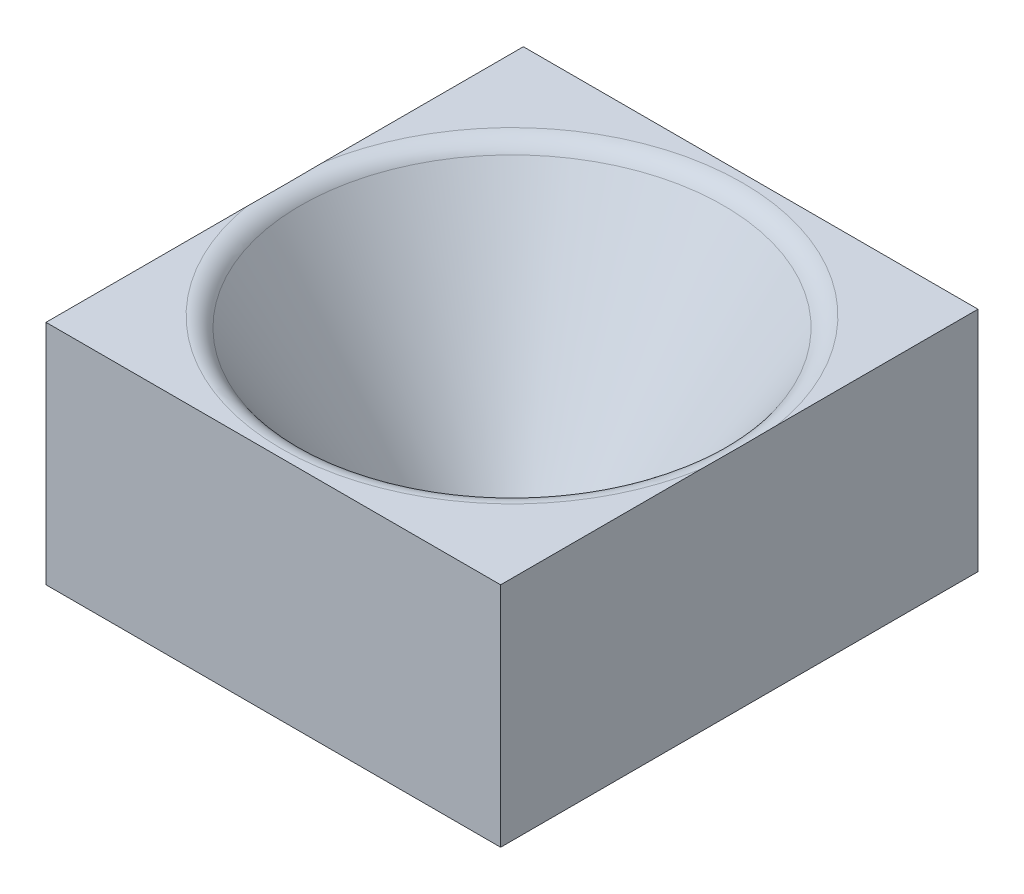
from build123d import *

# Parameters (mm, degrees)
SKETCH1_W           = 100
SKETCH1_H           = 105
BOSS_EXTRUDE1_DEPTH = 50
FILLET1_R           = 5
SKETCH8_W           = 22.5
SKETCH8_H           = 12.5
CUT_EXTRUDE4_DEPTH  = 30
SKETCH9_W           = 33.5
SKETCH9_H           = 12.5
CUT_EXTRUDE5_DEPTH  = 12


with BuildPart() as part:
    # Sketch1 → Boss-Extrude1 (new body)
    with BuildSketch(Plane(origin=(0, 0, 0), x_dir=(1, 0, 0), z_dir=(0, 1, 0))):
        Rectangle(SKETCH1_W, SKETCH1_H)
    extrude(amount=BOSS_EXTRUDE1_DEPTH)

    # Sketch5 → Cut-Revolve1 (revolve, cut)
    with BuildSketch(Plane(origin=(0, 0, 0), x_dir=(0, 0, -1), z_dir=(1, 0, 0))):
        Polygon((-48, 50), (-15, 0), (0, 0), (0, 50), align=None)
    revolve(axis=Axis((0, -20.231136995, 0), (0, 1, 0)), mode=Mode.SUBTRACT)

    # Fillet1
    # the kernel refuses this fillet: 5 mm, written as the material it takes off along each edge
    with BuildSketch(Plane(origin=(0, 50, 0), x_dir=(0, 0, 1), z_dir=(-1, 0, 0))) as fillet1_piece_1:
        with BuildLine():
            CenterArc((48 + FILLET1_R * 0.53816526406, -FILLET1_R), FILLET1_R, 90, 56.575188817)
            Line((48 - FILLET1_R * 0.296444142502, -FILLET1_R * 0.449157791669), (48, 0))
            Line((48, 0), (48 + FILLET1_R * 0.53816526406, 0))
        make_face()
    revolve(axis=Axis((0, 50, 0), (0, 1, 0)), mode=Mode.SUBTRACT)

    # Sketch8 → Cut-Extrude4 (cut)
    with BuildSketch(Plane.XZ):
        with Locations((-6.05, 42.323299426)):
            Rectangle(SKETCH8_W, SKETCH8_H)
    extrude(amount=-CUT_EXTRUDE4_DEPTH, mode=Mode.SUBTRACT)

    # Sketch9 → Cut-Extrude5 (cut)
    with BuildSketch(Plane.XZ):
        with Locations((-6.05, 42.323299426)):
            Rectangle(SKETCH9_W, SKETCH9_H)
    extrude(amount=-CUT_EXTRUDE5_DEPTH, mode=Mode.SUBTRACT)


solid = part.part
